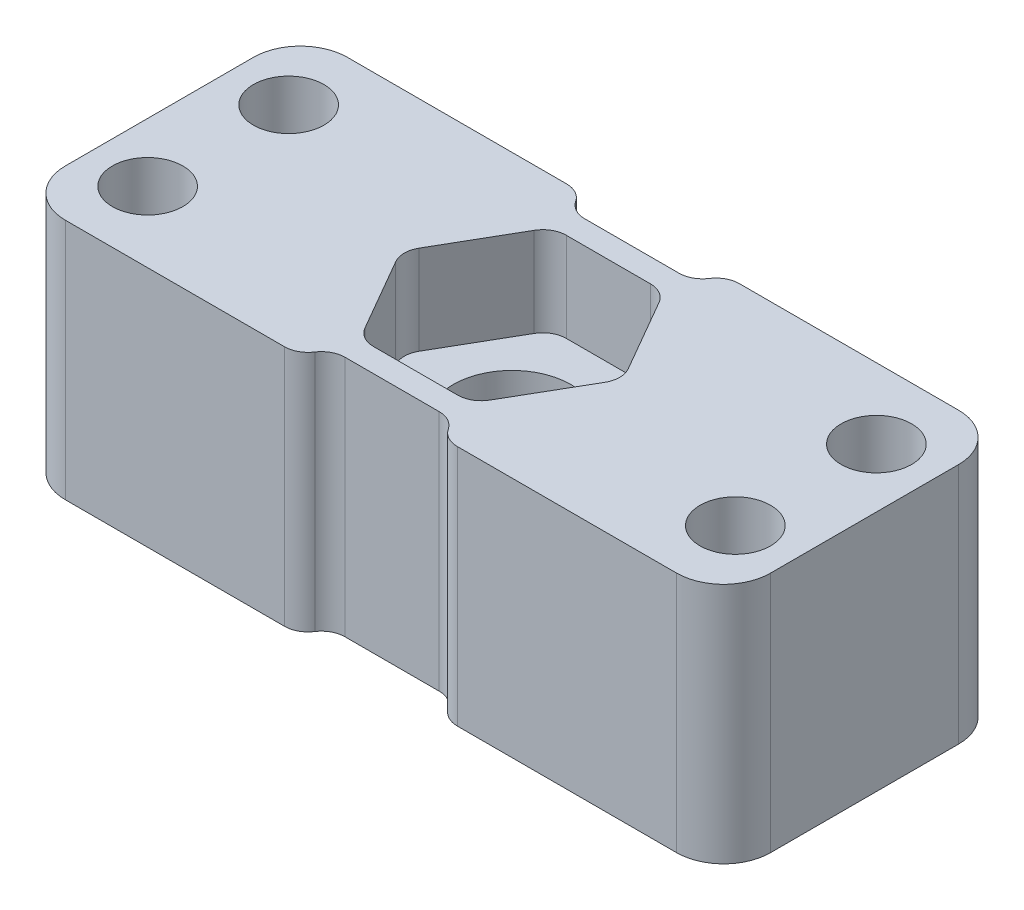
from build123d import *

# Parameters (mm, degrees)
SKETCH_1_R          = 1.5
SKETCH_1_R_2        = 2.5
EXTRUDE_1_DEPTH     = 10.3
CUT_EXTRUDE_1_DEPTH = 3.8
FILLET_1_R          = 2
FILLET_2_R          = 1
FILLET_3_R          = 1
FILLET_4_R          = 1


with BuildPart() as part:
    # 草图1 → 凸台-拉伸1 (new body)
    with BuildSketch(Plane(origin=(0, 0, 0), x_dir=(1, 0, 0), z_dir=(0, 1, 0))):
        Polygon((0, 12), (0, 0), (12, 0), (12, 0.9), (18, 0.9), (18, 0), (30, 0), (30, 12), (18, 12), (18, 11.1), (12, 11.1), (12, 12), align=None)
        with Locations(Location((2.5, 3, 0), (0, 0, 90))):
            Circle(SKETCH_1_R, mode=Mode.SUBTRACT)
        with Locations(Location((15, 6, 0), (0, 0, 90))):
            Circle(SKETCH_1_R_2, mode=Mode.SUBTRACT)
        with Locations(Location((27.5, 3, 0), (0, 0, 90))):
            Circle(SKETCH_1_R, mode=Mode.SUBTRACT)
        with Locations(Location((2.5, 9, 0), (0, 0, 90))):
            Circle(SKETCH_1_R, mode=Mode.SUBTRACT)
        with Locations(Location((27.5, 9, 0), (0, 0, 90))):
            Circle(SKETCH_1_R, mode=Mode.SUBTRACT)
    extrude(amount=EXTRUDE_1_DEPTH)

    # 草图2 → 切除-拉伸1 (cut)
    with BuildSketch(Plane(origin=(0, 10.3, 0), x_dir=(1, 0, 0), z_dir=(0, 1, 0))):
        Polygon((10.265727793, 6), (12.632863896, 1.9), (17.367136104, 1.9), (19.734272207, 6), (17.367136104, 10.1), (12.632863896, 10.1), align=None)
    extrude(amount=-CUT_EXTRUDE_1_DEPTH, mode=Mode.SUBTRACT)

    # 圆角1
    fillet_1_edges = [part.edges().sort_by_distance(p)[0] for p in [
        (30, 5.15, -12),
        (30, 5.15, 0),
        (0, 5.15, 0),
        (0, 5.15, -12),
    ]]
    fillet(fillet_1_edges, radius=FILLET_1_R)

    # 圆角2
    fillet_2_edges = [part.edges().sort_by_distance(p)[0] for p in [
        (10.265727793, 8.4, -6),
        (12.632863896, 8.4, -10.1),
        (17.367136104, 8.4, -10.1),
        (19.734272207, 8.4, -6),
        (17.367136104, 8.4, -1.9),
        (12.632863896, 8.4, -1.9),
    ]]
    fillet(fillet_2_edges, radius=FILLET_2_R)

    # 圆角3
    # the kernel refuses this fillet: 1 mm, written as the material it adds along each edge
    with BuildSketch(Plane(origin=(12, 0, -0.9), x_dir=(0, 0, 1), z_dir=(0, 1, 0))) as fillet_3_piece_1:
        with BuildLine():
            CenterArc((1, 0.994987437), FILLET_3_R, 180, 84.260829523)
            Line((0, 0.994987437), (-0.02, 0.994987437))
            Line((-0.02, 0.994987437), (-0.02, 0))
            Line((-0.02, 0), (0, -0.02))
            ThreePointArc((0, -0.02), (0.45, -0.02), (0.898, -0.019899749))
            Line((0.898, -0.019899749), (0.9, 0))
        make_face()
    extrude(amount=10.3)
    with BuildSketch(Plane(origin=(18, 0, -0.9), x_dir=(-1, 0, 0), z_dir=(0, 1, 0))) as fillet_3_piece_2:
        with BuildLine():
            CenterArc((0.994987437, 1), FILLET_3_R, 185.739170477, 84.260829523)
            Line((0, 0.9), (-0.019899749, 0.898))
            ThreePointArc((-0.019899749, 0.898), (-0.02, 0.45), (-0.02, 0))
            Line((-0.02, 0), (0, -0.02))
            Line((0, -0.02), (0.994987437, -0.02))
            Line((0.994987437, -0.02), (0.994987437, 0))
        make_face()
    extrude(amount=10.3)
    with BuildSketch(Plane(origin=(12, 0, -11.1), x_dir=(0, 0, -1), z_dir=(0, 1, 0))) as fillet_3_piece_3:
        with BuildLine():
            CenterArc((1, -0.994987437), FILLET_3_R, 95.739170477, 84.260829523)
            Line((0, -0.994987437), (-0.02, -0.994987437))
            Line((-0.02, -0.994987437), (-0.02, 0))
            Line((-0.02, 0), (0, 0.02))
            ThreePointArc((0, 0.02), (0.45, 0.02), (0.898, 0.019899749))
            Line((0.898, 0.019899749), (0.9, 0))
        make_face()
    extrude(amount=10.3)
    with BuildSketch(Plane(origin=(18, 0, -11.1), x_dir=(-1, 0, 0), z_dir=(0, 1, 0))) as fillet_3_piece_4:
        with BuildLine():
            CenterArc((0.994987437, -1), FILLET_3_R, 90, 84.260829523)
            Line((0, -0.9), (-0.019899749, -0.898))
            ThreePointArc((-0.019899749, -0.898), (-0.02, -0.45), (-0.02, 0))
            Line((-0.02, 0), (0, 0.02))
            Line((0, 0.02), (0.994987437, 0.02))
            Line((0.994987437, 0.02), (0.994987437, 0))
        make_face()
    extrude(amount=10.3)

    # 圆角4
    fillet_4_edges = [part.edges().sort_by_distance(p)[0] for p in [
        (18, 5.15, 0),
        (12, 5.15, 0),
        (12, 5.15, -12),
        (18, 5.15, -12),
    ]]
    fillet(fillet_4_edges, radius=FILLET_4_R)


solid = part.part
